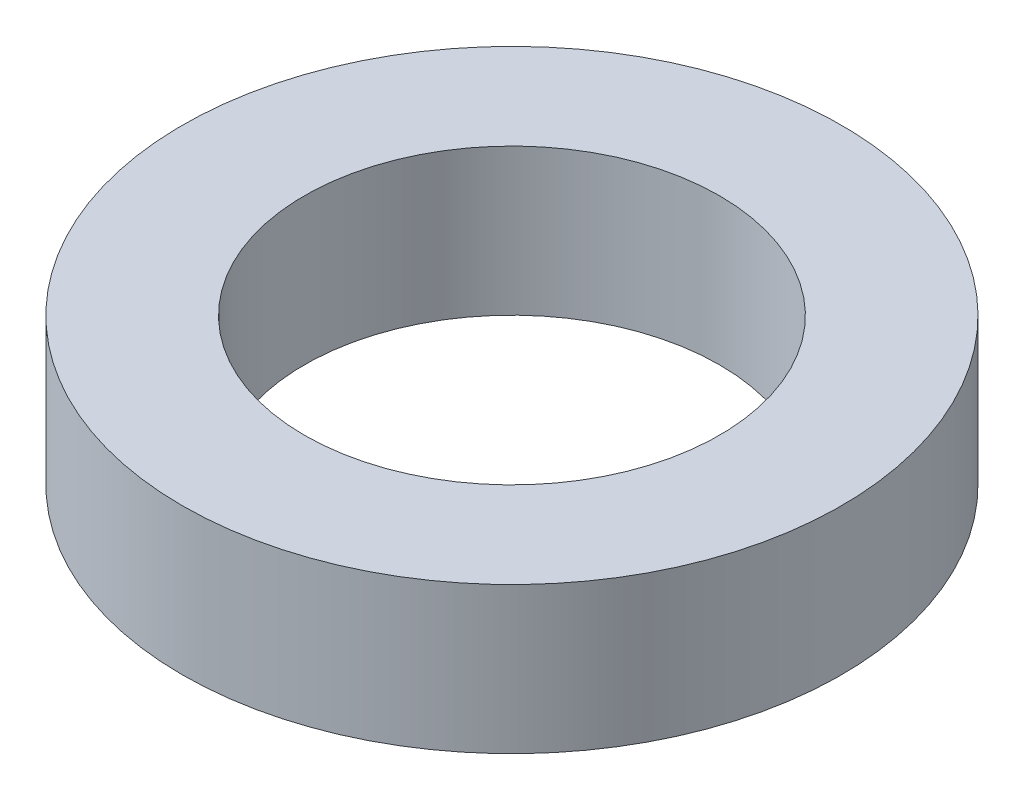
from build123d import *

# Parameters (mm, degrees)
SKETCH1_R           = 67.5
BOSS_EXTRUDE1_DEPTH = 30
SKETCH2_R           = 42.5
CUT_EXTRUDE1_DEPTH  = 101.062480481


with BuildPart() as part:
    # Sketch1 → Boss-Extrude1 (new body)
    with BuildSketch(Plane(origin=(0, 0, 0), x_dir=(1, 0, 0), z_dir=(0, 1, 0))):
        Circle(SKETCH1_R)
    extrude(amount=BOSS_EXTRUDE1_DEPTH)

    # Sketch2 → Cut-Extrude1 (cut, through all)
    with BuildSketch(Plane(origin=(0, 0, 0), x_dir=(1, 0, 0), z_dir=(0, 1, 0))):
        Circle(SKETCH2_R)
    extrude(amount=CUT_EXTRUDE1_DEPTH, mode=Mode.SUBTRACT)


solid = part.part
